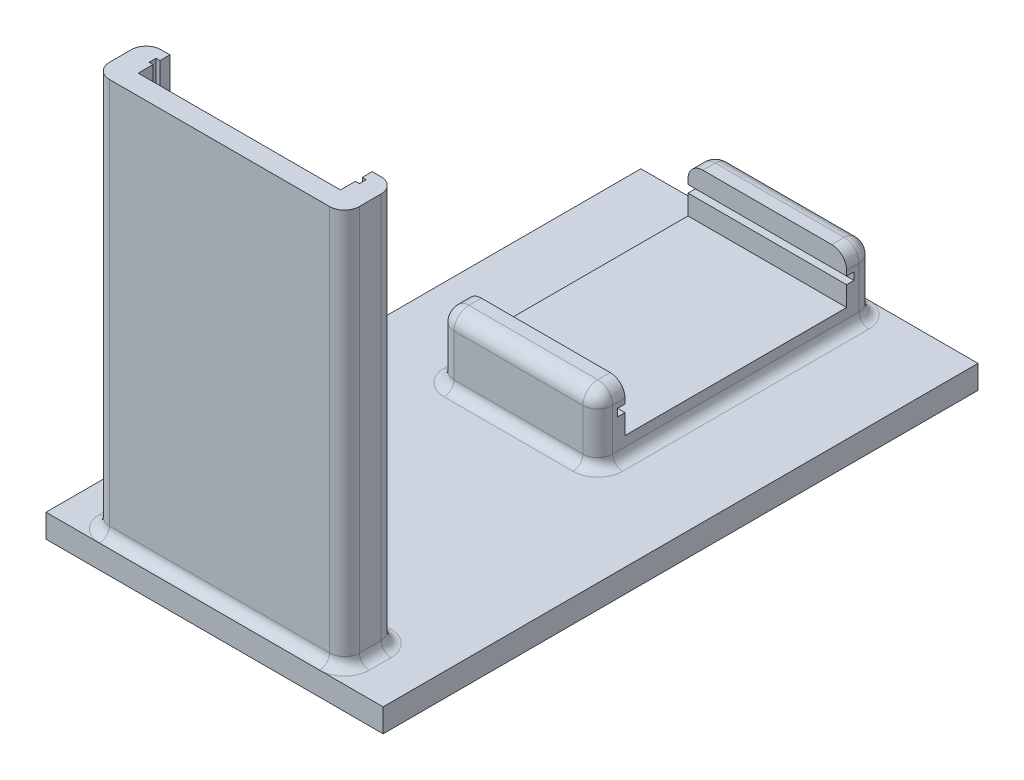
from build123d import *

# Parameters (mm, degrees)
SKETCH2_W               = 88.9
SKETCH2_H               = 152.4
BOSS_EXTRUDE1_DEPTH     = 5.9944
CUT_EXTRUDE2_DEPTH      = 177.535840076
CUT_EXTRUDE2_DEPTH_BACK = 177.535840076
SKETCH4_R               = 2.7305
BOSS_EXTRUDE2_DEPTH     = 101.6
FILLET1_R               = 3.81
FILLET2_R               = 2.54
BOSS_EXTRUDE3_DEPTH     = 20.32
FILLET3_R               = 3.81
FILLET6_R               = 3.81
FILLET7_R               = 2.54
CUT_EXTRUDE3_DEPTH      = 204.596488182
CUT_EXTRUDE3_DEPTH_BACK = 204.596488182
SKETCH7_W               = 2.54
SKETCH7_H               = 152.4


with BuildPart() as part:
    # Sketch2 → Boss-Extrude1 (new body)
    with BuildSketch(Plane(origin=(0, 0, 0), x_dir=(1, 0, 0), z_dir=(0, 1, 0))):
        with Locations((44.45, 76.2)):
            Rectangle(SKETCH2_W, SKETCH2_H)
    extrude(amount=BOSS_EXTRUDE1_DEPTH)

    # Sketch4 → Cut-Extrude2 (cut, two sides: drawn at the far end of the back side and taken through both)
    with BuildSketch(Plane(origin=(0, 5.9944, 0), x_dir=(1, 0, 0), z_dir=(0, 1, 0)).offset(-CUT_EXTRUDE2_DEPTH_BACK)):
        with Locations(Location((45.72, 109.871331367, 0), (0, 0, 270))):
            Circle(SKETCH4_R)
        with Locations(Location((45.72, 33.671331367, 0), (0, 0, 270))):
            Circle(SKETCH4_R)
    extrude(amount=CUT_EXTRUDE2_DEPTH + CUT_EXTRUDE2_DEPTH_BACK, mode=Mode.SUBTRACT)

    # Sketch5 → Boss-Extrude2 (add)
    with BuildSketch(Plane(origin=(0, 5.9944, 0), x_dir=(1, 0, 0), z_dir=(0, 1, 0))):
        Polygon((18.542, 15.748), (12.446, 15.748), (12.446, 2.54), (76.454, 2.54), (76.454, 15.748), (70.358, 15.748), (70.358, 13.208), (71.374, 13.208), (71.374, 11.43), (70.358, 11.43), (70.358, 7.62), (18.542, 7.62), (18.542, 11.43), (17.526, 11.43), (17.526, 13.208), (18.542, 13.208), align=None)
    extrude(amount=BOSS_EXTRUDE2_DEPTH)

    # Fillet1
    fillet1_edges = [part.edges().sort_by_distance(p)[0] for p in [
        (12.446, 56.7944, -15.748),
        (12.446, 56.7944, -2.54),
        (76.454, 56.7944, -2.54),
        (76.454, 56.7944, -15.748),
    ]]
    fillet(fillet1_edges, radius=FILLET1_R)

    # Fillet2
    fillet2_edges = [part.edges().sort_by_distance(p)[0] for p in [
        (71.501, 5.9944, -15.748),
        (44.45, 5.9944, -2.54),
        (12.446, 5.9944, -9.144),
        (17.399, 5.9944, -15.748),
        (76.454, 5.9944, -9.144),
        (13.561923164, 5.9944, -3.655923164),
        (13.561923164, 5.9944, -14.632076836),
        (75.338076836, 5.9944, -3.655923164),
        (75.338076836, 5.9944, -14.632076836),
    ]]
    fillet(fillet2_edges, radius=FILLET2_R - 0.0001)  # a hair under: the kernel refuses the full size

    # Sketch6 → Boss-Extrude3 (add, symmetric)
    with BuildSketch(Plane.ZY.offset(-44.45)):
        Polygon((-149.86, 5.9944), (-79.121, 5.9944), (-79.121, 23.1394), (-86.106, 23.1394), (-86.106, 18.0594), (-84.201, 18.0594), (-84.201, 16.1544), (-86.106, 16.1544), (-86.106, 11.0744), (-142.875, 11.0744), (-142.875, 16.1544), (-144.78, 16.1544), (-144.78, 18.0594), (-142.875, 18.0594), (-142.875, 23.1394), (-149.86, 23.1394), align=None)
    extrude(amount=BOSS_EXTRUDE3_DEPTH, both=True)

    # Fillet3
    fillet3_edges = [part.edges().sort_by_distance(p)[0] for p in [
        (44.45, 23.1394, -149.86),
        (44.45, 23.1394, -79.121),
    ]]
    fillet(fillet3_edges, radius=FILLET3_R)

    # Fillet6
    fillet6_edges = [part.edges().sort_by_distance(p)[0] for p in [
        (24.13, 12.6619, -149.86),
        (64.77, 12.6619, -79.121),
        (24.13, 23.1394, -84.5185),
        (24.13, 12.6619, -79.121),
        (64.77, 23.1394, -84.5185),
        (64.77, 12.6619, -149.86),
        (64.77, 23.1394, -144.4625),
        (64.77, 22.023476836, -148.744076836),
        (64.77, 22.023476836, -80.236923164),
        (24.13, 23.1394, -144.4625),
        (24.13, 22.023476836, -148.744076836),
        (24.13, 22.023476836, -80.236923164),
    ]]
    fillet(fillet6_edges, radius=FILLET6_R)

    # Fillet7
    fillet7_edges = [part.edges().sort_by_distance(p)[0] for p in [
        (24.13, 5.9944, -114.4905),
        (64.77, 5.9944, -114.4905),
        (44.45, 5.9944, -79.121),
        (44.45, 5.9944, -149.86),
        (25.245923164, 5.9944, -80.236923164),
        (63.654076836, 5.9944, -80.236923164),
        (63.654076836, 5.9944, -148.744076836),
        (25.245923164, 5.9944, -148.744076836),
    ]]
    fillet(fillet7_edges, radius=FILLET7_R - 0.0001)  # a hair under: the kernel refuses the full size

    # Sketch7 → Cut-Extrude3 (cut, two sides: drawn at the far end of the back side and taken through both)
    with BuildSketch(Plane(origin=(0, 5.9944, 0), x_dir=(1, 0, 0), z_dir=(0, 1, 0)).offset(-CUT_EXTRUDE3_DEPTH_BACK)):
        with Locations((1.27, 76.2)):
            Rectangle(SKETCH7_W, SKETCH7_H)
    extrude(amount=CUT_EXTRUDE3_DEPTH + CUT_EXTRUDE3_DEPTH_BACK, mode=Mode.SUBTRACT)


solid = part.part
